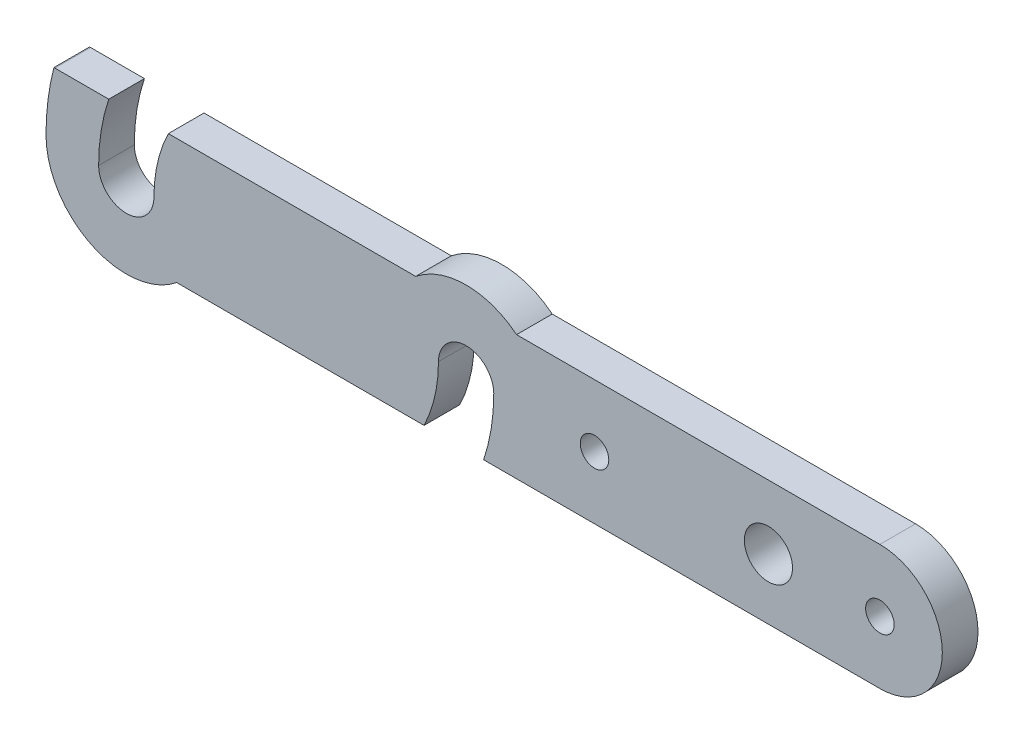
from build123d import *

# Parameters (mm, degrees)
SKETCH1_R           = 2.7
SKETCH1_R_2         = 1.6
BOSS_EXTRUDE1_DEPTH = 4


with BuildPart() as part:
    # Sketch1 → Boss-Extrude1 (new body)
    with BuildSketch(Plane.XY):
        with BuildLine():
            Line((33.376112415, 4), (74.112592823, 4))
            ThreePointArc((74.112592823, 4), (81.112592823, -3), (74.112592823, -10))
            Line((74.112592823, -10), (29.684209397, -10))
            ThreePointArc((29.684209397, -10), (30.533654889, -6.545713458), (30.819258166, -3))
            ThreePointArc((30.819258166, -3), (27.719258166, 0.1), (24.619258166, -3))
            ThreePointArc((24.619258166, -3), (24.209534573, -6.592263604), (23.001410455, -10))
            Line((23.001410455, -10), (-4.728887585, -10))
            ThreePointArc((-4.728887585, -10), (-14.264421491, -11.121320344), (-19.385741834, -3))
            ThreePointArc((-19.385741834, -3), (-19.1630671, 0.527546162), (-18.498577986, 3.999090513))
            ThreePointArc((-18.498577986, 3.999090513), (-18.442161743, 3.999772624), (-18.385741834, 4))
            Line((-18.385741834, 4), (-12.350693065, 4))
            ThreePointArc((-12.350693065, 4), (-13.200138558, 0.545713458), (-13.485741834, -3))
            ThreePointArc((-13.485741834, -3), (-10.385741834, -6.1), (-7.285741834, -3))
            ThreePointArc((-7.285741834, -3), (-6.876018242, 0.592263604), (-5.667894123, 4))
            Line((-5.667894123, 4), (22.062403916, 4))
            ThreePointArc((22.062403916, 4), (27.719258166, 6), (33.376112415, 4))
        make_face()
        with Locations((61.614011825, -3.188342853)):
            Circle(SKETCH1_R, mode=Mode.SUBTRACT)
        with Locations((74.112592823, -3)):
            Circle(SKETCH1_R_2, mode=Mode.SUBTRACT)
        with Locations((42.114921411, -3)):
            Circle(SKETCH1_R_2, mode=Mode.SUBTRACT)
    extrude(amount=BOSS_EXTRUDE1_DEPTH)


solid = part.part
